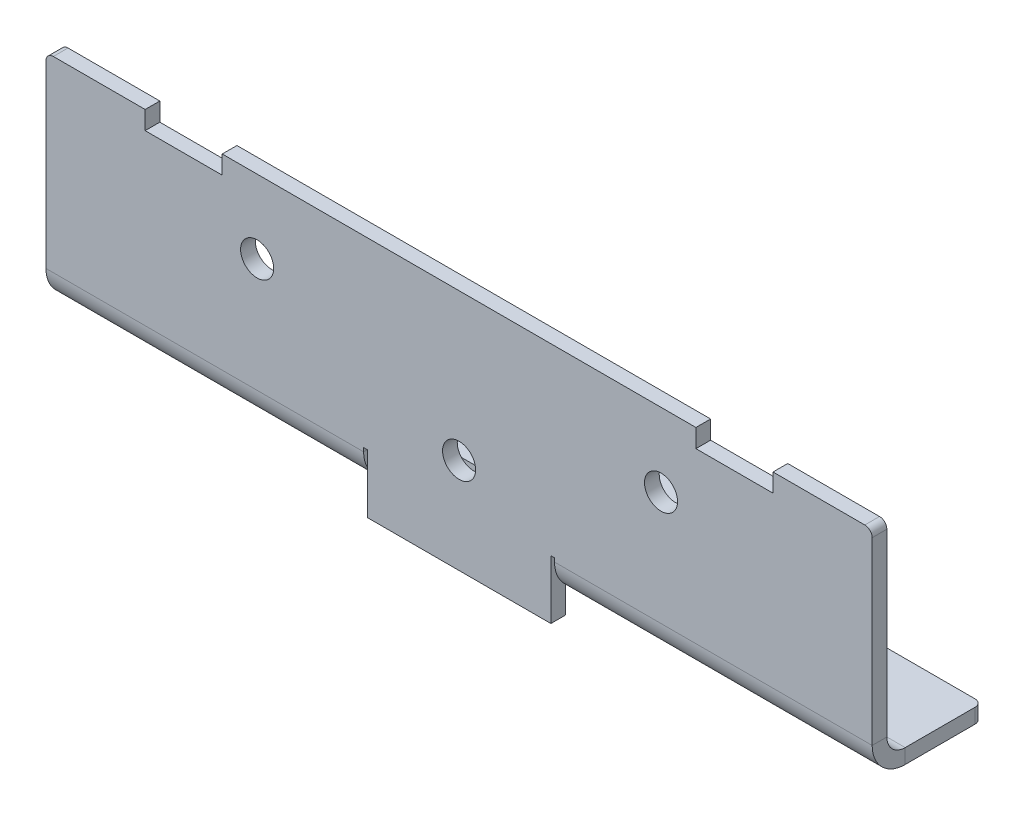
from build123d import *

# Parameters (mm, degrees)
SKETCH_6_W                       = 225
SKETCH_6_H                       = 60
SM_BASE_FLANGE_1_DEPTH           = 4
SM_EDGE_FLANGE_1_STRIP_W         = 26
SM_EDGE_FLANGE_1_STRIP_H         = 4
SM_EDGE_FLANGE_1_STRIP_CUT_DEPTH = 225
SM_EDGE_FLANGE_1_DEPTH           = 225
CUT_EXTRUDE_2_DEPTH              = 5
HOLE_WIZARD_M81_D                = 9
SKETCH_21_W                      = 52
SKETCH_21_H                      = 17
CUT_EXTRUDE_3_DEPTH              = 10
SKETCH_22_W                      = 50
SKETCH_22_H                      = 16
EXTRUDE_1_DEPTH                  = 4
SKETCH_23_W                      = 21
SKETCH_23_H                      = 5
CUT_EXTRUDE_4_DEPTH              = 10
SKETCH_26_R                      = 4.5
CUT_EXTRUDE_5_DEPTH              = 15
FILLET_1_R                       = 2


# Sheet-metal steps are written as plain solids
with BuildPart() as part:
    # Эскиз6 → Базовая кромка1 (new body)
    with BuildSketch(Plane.XY):
        Rectangle(SKETCH_6_W, SKETCH_6_H)
    extrude(amount=-SM_BASE_FLANGE_1_DEPTH)

    # Ребро-кромка1 strip (across the edge) → Ребро-кромка1 strip cut (cut)
    with BuildSketch(Plane(origin=(112.5, -30, -4), x_dir=(0, 1, 0), z_dir=(-1, 0, 0))):
        with Locations((-4, -2)):
            Rectangle(SM_EDGE_FLANGE_1_STRIP_W, SM_EDGE_FLANGE_1_STRIP_H)
    extrude(amount=SM_EDGE_FLANGE_1_STRIP_CUT_DEPTH, mode=Mode.SUBTRACT)

    # Ребро-кромка1 section (across the edge) → Ребро-кромка1 (add)
    with BuildSketch(Plane(origin=(112.5, -30, -4), x_dir=(0, 1, 0), z_dir=(-1, 0, 0))):
        with BuildLine():
            Line((0, 5), (0, 41))
            Line((0, 41), (4, 41))
            Line((4, 41), (4, 5))
            ThreePointArc((4, 5), (5.464466094, 1.464466094), (9, 0))
            Line((9, 0), (9, -4))
            ThreePointArc((9, -4), (2.636038969, -1.363961031), (0, 5))
        make_face()
    extrude(amount=SM_EDGE_FLANGE_1_DEPTH)

    # Эскиз15 → Вырез-Вытянуть2 (cut)
    with BuildSketch(Plane.XZ.offset(30)):
        Polygon((-112.5, -45), (-112.5, -30), (-30, -30), (-15, -45), align=None)
        Polygon((15, -45), (112.5, -45), (112.5, -30), (30, -30), align=None)
    extrude(amount=-CUT_EXTRUDE_2_DEPTH, mode=Mode.SUBTRACT)

    # Отверстие с зазором M81 (through all)
    with Locations(Plane(origin=(0, -30, 0), x_dir=(-1, 0, 0), z_dir=(0, -1, 0))):
        with Locations((-75, 20), (75, 20), (0, 35)):
            Hole(HOLE_WIZARD_M81_D / 2)

    # Эскиз21 → Вырез-Вытянуть3 (cut)
    with BuildSketch(Plane.XZ.offset(30)):
        with Locations((0, -8.5)):
            Rectangle(SKETCH_21_W, SKETCH_21_H)
    extrude(amount=-CUT_EXTRUDE_3_DEPTH, mode=Mode.SUBTRACT)

    # Эскиз22 → Бобышка-Вытянуть1 (add)
    with BuildSketch(Plane.XY):
        with Locations((0, -28)):
            Rectangle(SKETCH_22_W, SKETCH_22_H)
    extrude(amount=-EXTRUDE_1_DEPTH)

    # Эскиз23 → Вырез-Вытянуть4 (cut)
    with BuildSketch(Plane.XY):
        with Locations((-75, 27.5)):
            Rectangle(SKETCH_23_W, SKETCH_23_H)
        with Locations((75, 27.5)):
            Rectangle(SKETCH_23_W, SKETCH_23_H)
    extrude(amount=-CUT_EXTRUDE_4_DEPTH, mode=Mode.SUBTRACT)

    # Эскиз26 → Вырез-Вытянуть5 (cut)
    with BuildSketch(Plane(origin=(0, 0, -4), x_dir=(-1, 0, 0), z_dir=(0, 0, -1))):
        with Locations((-55, 10)):
            Circle(SKETCH_26_R)
        with Locations((55, 10)):
            Circle(SKETCH_26_R)
        with Locations((0, -10)):
            Circle(SKETCH_26_R)
    extrude(amount=-CUT_EXTRUDE_5_DEPTH, mode=Mode.SUBTRACT)

    # Скругление1
    fillet_1_edges = [part.edges().sort_by_distance(p)[0] for p in [
        (15, -28, -45),
        (-15, -28, -45),
        (-112.5, -28, -30),
        (-30, -28, -30),
        (30, -28, -30),
        (112.5, -28, -30),
        (-112.5, 30, -2),
        (112.5, 30, -2),
    ]]
    fillet(fillet_1_edges, radius=FILLET_1_R)


solid = part.part
